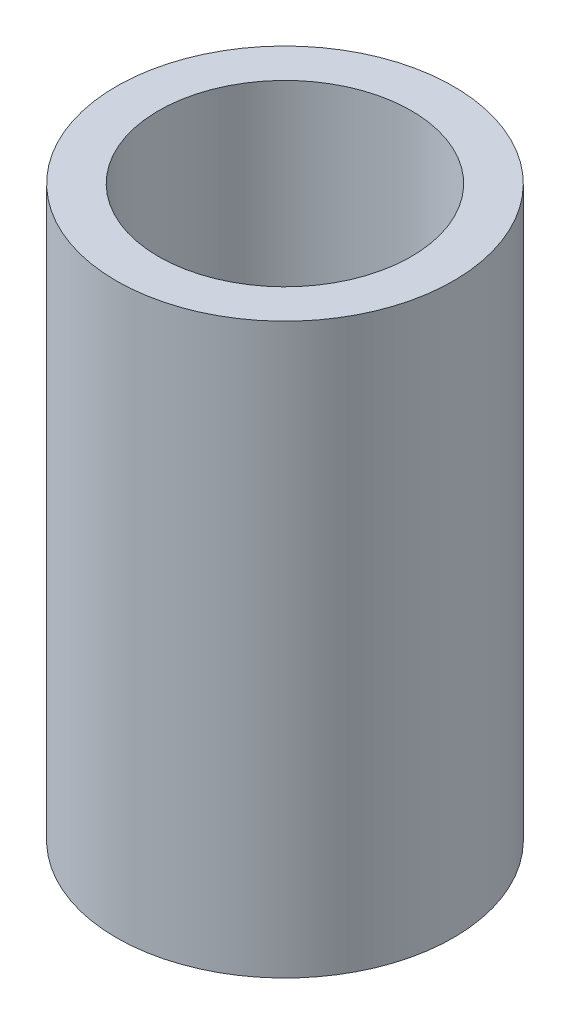
from build123d import *

# Parameters (mm, degrees)
SKETCH1_R           = 8
SKETCH1_R_2         = 6
BOSS_EXTRUDE1_DEPTH = 27


with BuildPart() as part:
    # Sketch1 → Boss-Extrude1 (new body)
    with BuildSketch(Plane(origin=(0, 0, 0), x_dir=(1, 0, 0), z_dir=(0, 1, 0))):
        Circle(SKETCH1_R)
        Circle(SKETCH1_R_2, mode=Mode.SUBTRACT)
    extrude(amount=BOSS_EXTRUDE1_DEPTH)


solid = part.part
